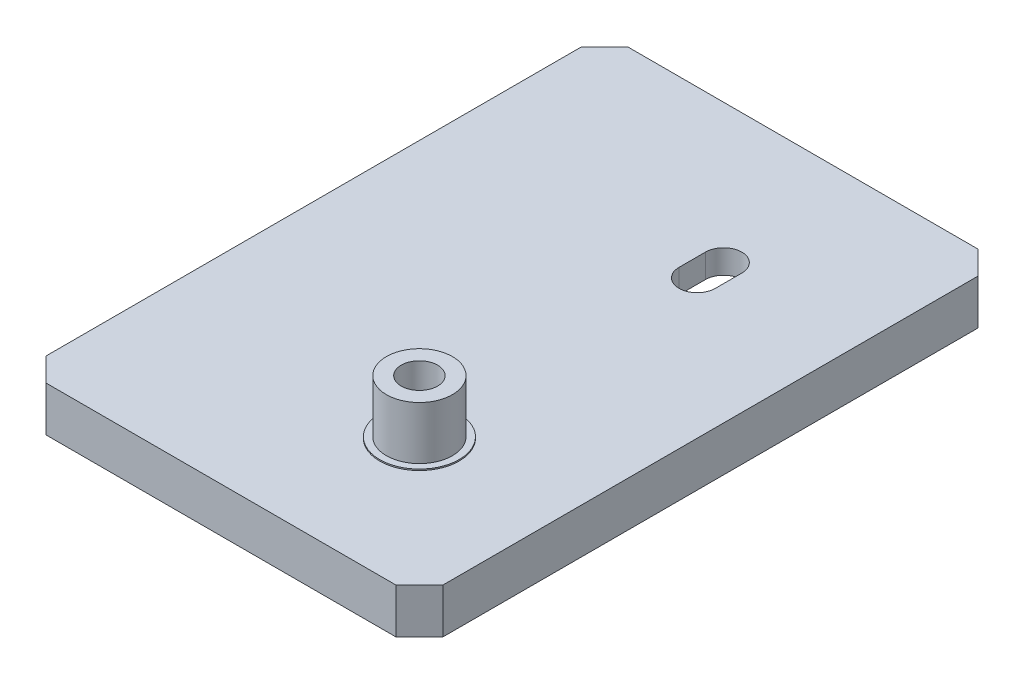
from build123d import *

# Parameters (mm, degrees)
SKETCH_1_W          = 60
SKETCH_1_H          = 88
EXTRUDE_1_DEPTH     = 6.8
SKETCH_2_R          = 2.75
CUT_EXTRUDE_6_DEPTH = 63.659715927
SKETCH_3_R          = 11.05
CUT_EXTRUDE_7_DEPTH = 3.2
SKETCH_4_R          = 4.99
SKETCH_4_R_2        = 2.75
EXTRUDE_2_DEPTH     = 8.2
SKETCH_5_R          = 6
SKETCH_5_R_2        = 4
EXTRUDE_1327_DEPTH  = 0.2
CHAMFER_1_SIZE      = 3.535533906


with BuildPart() as part:
    # 草图1 → 凸台-拉伸1 (new body)
    with BuildSketch(Plane(origin=(0, 0, 0), x_dir=(1, 0, 0), z_dir=(0, 1, 0))):
        with Locations((12, 2)):
            Rectangle(SKETCH_1_W, SKETCH_1_H)
    extrude(amount=EXTRUDE_1_DEPTH)

    # 草图2 → 切除-拉伸6 (cut, through all)
    with BuildSketch(Plane(origin=(0, 0, 0), x_dir=(1, 0, 0), z_dir=(0, 1, 0))):
        with Locations((21, -21)):
            Circle(SKETCH_2_R)
        with BuildLine():
            Line((18.25, 21), (18.25, 25))
            ThreePointArc((18.25, 25), (21, 27.75), (23.75, 25))
            Line((23.75, 25), (23.75, 21))
            ThreePointArc((23.75, 21), (21, 18.25), (18.25, 21))
        make_face()
    extrude(amount=CUT_EXTRUDE_6_DEPTH, mode=Mode.SUBTRACT)

    # 草图3 → 切除-拉伸7 (cut)
    with BuildSketch(Plane.XZ):
        with Locations((21, 21)):
            Circle(SKETCH_3_R)
        with BuildLine():
            Line((32.05, -21), (32.05, -25))
            ThreePointArc((32.05, -25), (21, -36.05), (9.95, -25))
            Line((9.95, -25), (9.95, -21))
            ThreePointArc((9.95, -21), (21, -9.95), (32.05, -21))
        make_face()
    extrude(amount=-CUT_EXTRUDE_7_DEPTH, mode=Mode.SUBTRACT)

    # 草图4 → 凸台-拉伸2 (add)
    with BuildSketch(Plane(origin=(0, 6.8, 0), x_dir=(1, 0, 0), z_dir=(0, 1, 0))):
        with Locations((21, -21)):
            Circle(SKETCH_4_R)
        with Locations((21, -21)):
            Circle(SKETCH_4_R_2, mode=Mode.SUBTRACT)
    extrude(amount=EXTRUDE_2_DEPTH)

    # 草图5 → Extrude 1327 (add)
    with BuildSketch(Plane(origin=(0, 6.8, 0), x_dir=(1, 0, 0), z_dir=(0, 1, 0))):
        with Locations((21, -21)):
            Circle(SKETCH_5_R)
        with Locations((21, -21)):
            Circle(SKETCH_5_R_2, mode=Mode.SUBTRACT)
    extrude(amount=EXTRUDE_1327_DEPTH)

    # 倒角1
    chamfer_1_edges = [part.edges().sort_by_distance(p)[0] for p in [
        (42, 3.4, -46),
        (42, 3.4, 42),
        (-18, 3.4, 42),
        (-18, 3.4, -46),
    ]]
    chamfer(chamfer_1_edges, length=CHAMFER_1_SIZE)


solid = part.part
